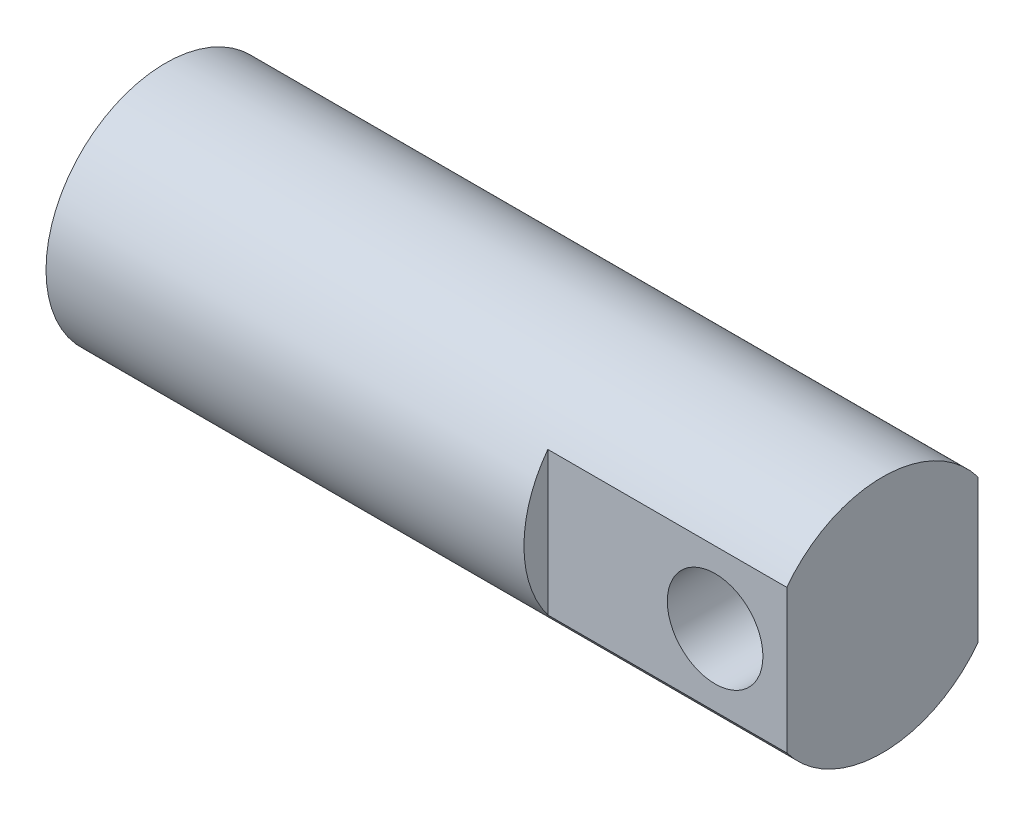
from build123d import *

# Parameters (mm, degrees)
SKETCH1_W               = 30
SKETCH1_H               = 5
CUT_EXTRUDE1_DEPTH      = 10
CUT_EXTRUDE1_DEPTH_BACK = 10
SKETCH2_R               = 2
CUT_EXTRUDE2_DEPTH      = 10
CUT_EXTRUDE2_DEPTH_BACK = 10
SKETCH3_W               = 10
SKETCH3_H               = 1


with BuildPart() as part:
    # Sketch1 → Revolve1 (revolve)
    with BuildSketch(Plane.XY):
        with Locations((0, 2.5)):
            Rectangle(SKETCH1_W, SKETCH1_H)
    revolve(axis=Axis((-15, 0, 0), (1, 0, 0)))

    # Sketch2 → Cut-Extrude1 (cut, two sides: drawn at the far end of the back side and taken through both)
    with BuildSketch(Plane.XY.offset(-CUT_EXTRUDE1_DEPTH_BACK)):
        with Locations((12, 0)):
            Circle(SKETCH2_R)
    extrude(amount=CUT_EXTRUDE1_DEPTH + CUT_EXTRUDE1_DEPTH_BACK, mode=Mode.SUBTRACT)

    # Sketch3 → Cut-Extrude2 (cut, two sides: drawn at the far end of the back side and taken through both)
    with BuildSketch(Plane(origin=(0, 0, 0), x_dir=(1, 0, 0), z_dir=(0, 1, 0)).offset(-CUT_EXTRUDE2_DEPTH_BACK)):
        with Locations((10, 4.5)):
            Rectangle(SKETCH3_W, SKETCH3_H)
        with Locations((10, -4.5)):
            Rectangle(SKETCH3_W, SKETCH3_H)
    extrude(amount=CUT_EXTRUDE2_DEPTH + CUT_EXTRUDE2_DEPTH_BACK, mode=Mode.SUBTRACT)


solid = part.part
